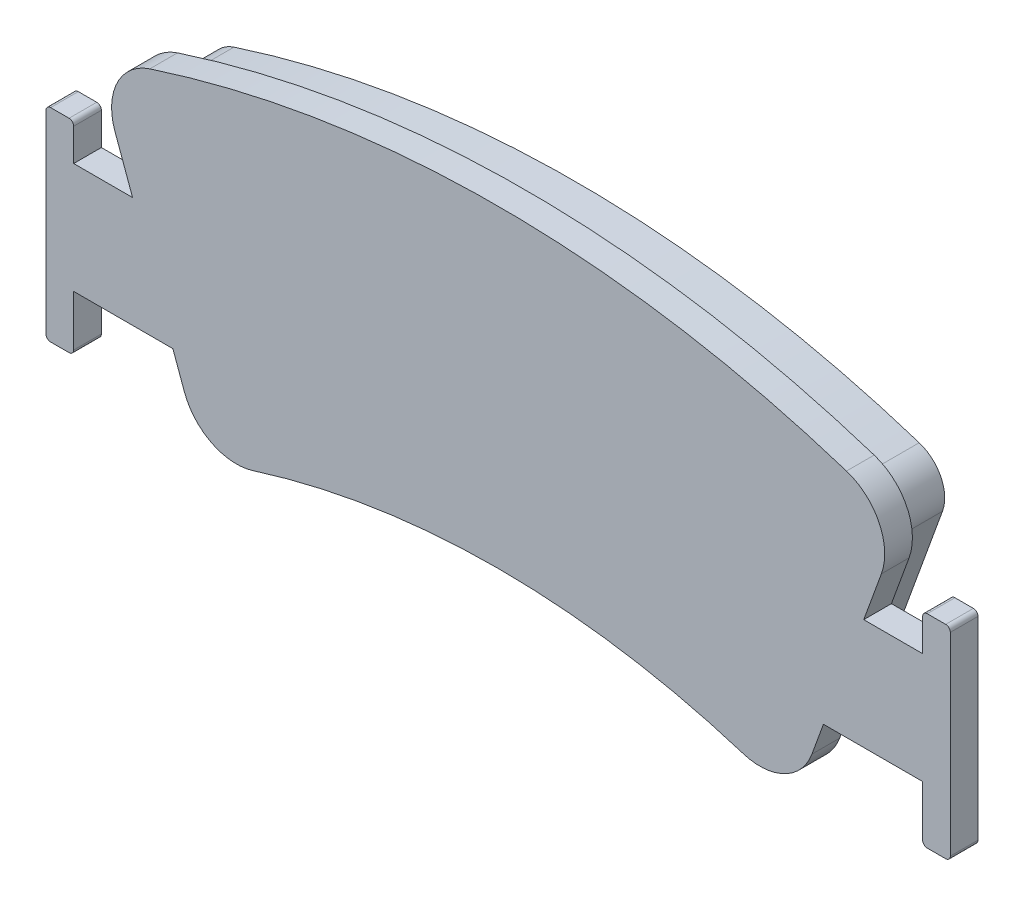
from build123d import *
from OCP.BRepFilletAPI import BRepFilletAPI_MakeChamfer

# Parameters (mm, degrees)
DODANIE_WYCI_GNI_CIE1_DEPTH = 6.5
DODANIE_WYCI_GNI_CIE2_DEPTH = 3
SFAZOWANIE1_SIZE            = 1
SFAZOWANIE1_SIZE2           = 2.747477419


with BuildPart() as part:
    # Szkic2 → Dodanie-wyciągnięcie1 (new body)
    with BuildSketch(Plane.XY):
        with BuildLine():
            Line((-39.650742014, 108.939518347), (-32.120772186, 88.251096277))
            ThreePointArc((-32.120772186, 88.251096277), (-30.12924195, 86.030742386), (-27.155108014, 85.805594857))
            ThreePointArc((-27.155108014, 85.805594857), (-13.738567299, 88.945217795), (0, 90))
            Line((0, 90), (0, 120))
            ThreePointArc((0, 120), (-18.796846712, 118.518684408), (-37.129625721, 114.111309228))
            ThreePointArc((-37.129625721, 114.111309228), (-39.48751323, 112.060333895), (-39.650742014, 108.939518347))
        make_face()
    dodanie_wyci_gni_cie1 = extrude(amount=DODANIE_WYCI_GNI_CIE1_DEPTH)

    # Szkic3 → Dodanie-wyciągnięcie2 (add)
    with BuildSketch(Plane.XY.offset(6.5)):
        with BuildLine():
            Line((-46, 91), (-35.249646863, 91))
            Line((-35.249646863, 91), (-34.000157428, 87.567055991))
            ThreePointArc((-34.000157428, 87.567055991), (-31.012862074, 84.236525153), (-26.551661169, 83.89880386))
            ThreePointArc((-26.551661169, 83.89880386), (-13.433265804, 86.968657399), (0, 88))
            Line((0, 88), (0, 122))
            ThreePointArc((0, 122), (-19.11012749, 120.493995814), (-37.748452817, 116.013164382))
            ThreePointArc((-37.748452817, 116.013164382), (-41.285284079, 112.936701382), (-41.530127255, 108.255478061))
            Line((-41.530127255, 108.255478061), (-39.617289674, 103))
            Line((-39.617289674, 103), (-46, 103))
            Line((-46, 103), (-46, 106.5))
            ThreePointArc((-46, 106.5), (-46.146446609, 106.853553391), (-46.5, 107))
            Line((-46.5, 107), (-48.5, 107))
            ThreePointArc((-48.5, 107), (-48.853553391, 106.853553391), (-49, 106.5))
            Line((-49, 106.5), (-49, 85.5))
            ThreePointArc((-49, 85.5), (-48.853553391, 85.146446609), (-48.5, 85))
            Line((-48.5, 85), (-46.5, 85))
            ThreePointArc((-46.5, 85), (-46.146446609, 85.146446609), (-46, 85.5))
            Line((-46, 85.5), (-46, 91))
        make_face()
    dodanie_wyci_gni_cie2 = extrude(amount=DODANIE_WYCI_GNI_CIE2_DEPTH)

    # Lustro1: Dodanie-wyciągnięcie1, Dodanie-wyciągnięcie2 across plane
    add(dodanie_wyci_gni_cie1.mirror(Plane(origin=(0, 0, 0), x_dir=(0, 0, 1), z_dir=(1, 0, 0))))
    add(dodanie_wyci_gni_cie2.mirror(Plane(origin=(0, 0, 0), x_dir=(0, 0, 1), z_dir=(1, 0, 0))))

    # Sfazowanie1: one chamfer whose edges measure the first distance from different faces: ONE call of the kernel's chamfer builder (chamfer() names one face for all edges)
    sfazowanie1_edges_1 = [part.edges().sort_by_distance(p)[0] for p in [
        (35.8857571, 98.595307312, 0),
    ]]
    sfazowanie1_side_1 = [part.faces().sort_by_distance(p)[0] for p in [
        (35.8857571, 98.595307312, 3.25),
    ]]
    sfazowanie1_edges_2 = [part.edges().sort_by_distance(p)[0] for p in [
        (30.12924195, 86.030742386, 0),
    ]]
    sfazowanie1_side_2 = [part.faces().sort_by_distance(p)[0] for p in [
        (30.12924195, 86.030742386, 3.25),
    ]]
    sfazowanie1_edges_3 = [part.edges().sort_by_distance(p)[0] for p in [
        (39.48751323, 112.060333895, 0),
    ]]
    sfazowanie1_side_3 = [part.faces().sort_by_distance(p)[0] for p in [
        (39.48751323, 112.060333895, 3.25),
    ]]
    sfazowanie1_edges_4 = [part.edges().sort_by_distance(p)[0] for p in [
        (0, 90, 0),
    ]]
    sfazowanie1_side_4 = [part.faces().sort_by_distance(p)[0] for p in [
        (0, 90, 3.25),
    ]]
    sfazowanie1_edges_5 = [part.edges().sort_by_distance(p)[0] for p in [
        (0, 120, 0),
    ]]
    sfazowanie1_side_5 = [part.faces().sort_by_distance(p)[0] for p in [
        (0, 120, 3.25),
    ]]
    sfazowanie1_edges_6 = [part.edges().sort_by_distance(p)[0] for p in [
        (-30.12924195, 86.030742386, 0),
    ]]
    sfazowanie1_side_6 = [part.faces().sort_by_distance(p)[0] for p in [
        (-30.12924195, 86.030742386, 3.25),
    ]]
    sfazowanie1_edges_7 = [part.edges().sort_by_distance(p)[0] for p in [
        (-39.48751323, 112.060333895, 0),
    ]]
    sfazowanie1_side_7 = [part.faces().sort_by_distance(p)[0] for p in [
        (-39.48751323, 112.060333895, 3.25),
    ]]
    sfazowanie1_edges_8 = [part.edges().sort_by_distance(p)[0] for p in [
        (-35.8857571, 98.595307312, 0),
    ]]
    sfazowanie1_side_8 = [part.faces().sort_by_distance(p)[0] for p in [
        (-35.8857571, 98.595307312, 3.25),
    ]]
    sfazowanie1 = BRepFilletAPI_MakeChamfer(part.part.solid().wrapped)
    for e in sfazowanie1_edges_1:
        sfazowanie1.Add(SFAZOWANIE1_SIZE, SFAZOWANIE1_SIZE2, e.wrapped, sfazowanie1_side_1[0].wrapped)  # the first distance lies on this face
    for e in sfazowanie1_edges_2:
        sfazowanie1.Add(SFAZOWANIE1_SIZE, SFAZOWANIE1_SIZE2, e.wrapped, sfazowanie1_side_2[0].wrapped)  # the first distance lies on this face
    for e in sfazowanie1_edges_3:
        sfazowanie1.Add(SFAZOWANIE1_SIZE, SFAZOWANIE1_SIZE2, e.wrapped, sfazowanie1_side_3[0].wrapped)  # the first distance lies on this face
    for e in sfazowanie1_edges_4:
        sfazowanie1.Add(SFAZOWANIE1_SIZE, SFAZOWANIE1_SIZE2, e.wrapped, sfazowanie1_side_4[0].wrapped)  # the first distance lies on this face
    for e in sfazowanie1_edges_5:
        sfazowanie1.Add(SFAZOWANIE1_SIZE, SFAZOWANIE1_SIZE2, e.wrapped, sfazowanie1_side_5[0].wrapped)  # the first distance lies on this face
    for e in sfazowanie1_edges_6:
        sfazowanie1.Add(SFAZOWANIE1_SIZE, SFAZOWANIE1_SIZE2, e.wrapped, sfazowanie1_side_6[0].wrapped)  # the first distance lies on this face
    for e in sfazowanie1_edges_7:
        sfazowanie1.Add(SFAZOWANIE1_SIZE, SFAZOWANIE1_SIZE2, e.wrapped, sfazowanie1_side_7[0].wrapped)  # the first distance lies on this face
    for e in sfazowanie1_edges_8:
        sfazowanie1.Add(SFAZOWANIE1_SIZE, SFAZOWANIE1_SIZE2, e.wrapped, sfazowanie1_side_8[0].wrapped)  # the first distance lies on this face
    add(Compound.cast(sfazowanie1.Shape()), mode=Mode.REPLACE)


solid = part.part
